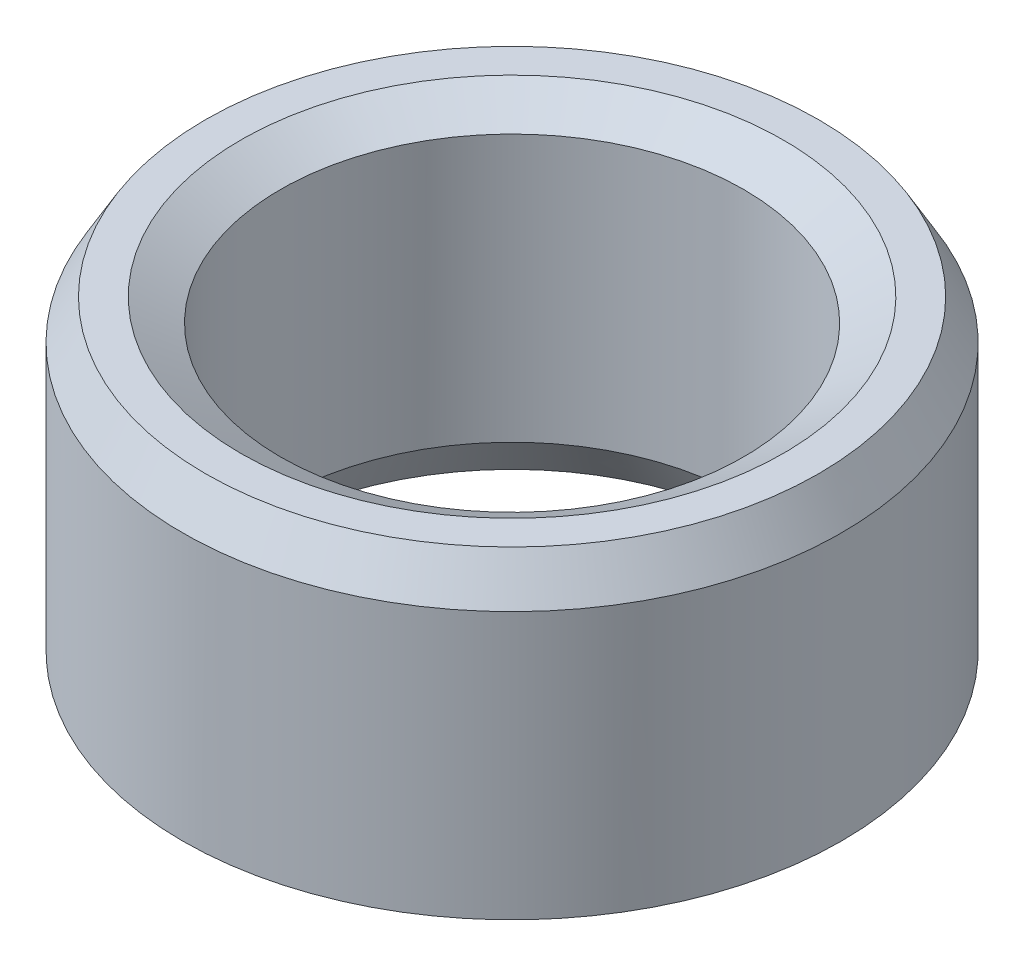
from build123d import *
from OCP.BRepFilletAPI import BRepFilletAPI_MakeChamfer

# Parameters (mm, degrees)
SKETCH1_R           = 30
BOSS_EXTRUDE1_DEPTH = 29.999267997
SKETCH2_R           = 21.0873478
CUT_EXTRUDE1_DEPTH  = 52.961101608
CHAMFER1_SIZE       = 3.616942183
CHAMFER1_SIZE2      = 2.088242543


with BuildPart() as part:
    # Sketch1 → Boss-Extrude1 (new body)
    with BuildSketch(Plane(origin=(0, 0, 0), x_dir=(1, 0, 0), z_dir=(0, 1, 0))):
        Circle(SKETCH1_R)
    extrude(amount=BOSS_EXTRUDE1_DEPTH)

    # Sketch2 → Cut-Extrude1 (cut, through all)
    with BuildSketch(Plane(origin=(0, 0, 0), x_dir=(1, 0, 0), z_dir=(0, 1, 0))):
        Circle(SKETCH2_R)
    extrude(amount=CUT_EXTRUDE1_DEPTH, mode=Mode.SUBTRACT)

    # Chamfer1: one chamfer whose edges measure the first distance from different faces: ONE call of the kernel's chamfer builder (chamfer() names one face for all edges)
    chamfer1_edges_1 = [part.edges().sort_by_distance(p)[0] for p in [
        (-21.0873478, 29.999267997, 0),
    ]]
    chamfer1_side_1 = [part.faces().sort_by_distance(p)[0] for p in [
        (-29.151471863, 29.999267997, 0),
    ]]
    chamfer1_edges_2 = [part.edges().sort_by_distance(p)[0] for p in [
        (-21.0873478, 0, 0),
    ]]
    chamfer1_side_2 = [part.faces().sort_by_distance(p)[0] for p in [
        (-21.0873478, 14.999633999, 0),
    ]]
    chamfer1_edges_3 = [part.edges().sort_by_distance(p)[0] for p in [
        (-30, 0, 0),
    ]]
    chamfer1_side_3 = [part.faces().sort_by_distance(p)[0] for p in [
        (-29.151471863, 0, 0),
    ]]
    chamfer1_edges_4 = [part.edges().sort_by_distance(p)[0] for p in [
        (-30, 29.999267997, 0),
    ]]
    chamfer1_side_4 = [part.faces().sort_by_distance(p)[0] for p in [
        (-30, 14.999633999, 0),
    ]]
    chamfer1 = BRepFilletAPI_MakeChamfer(part.part.solid().wrapped)
    for e in chamfer1_edges_1:
        chamfer1.Add(CHAMFER1_SIZE, CHAMFER1_SIZE2, e.wrapped, chamfer1_side_1[0].wrapped)  # the first distance lies on this face
    for e in chamfer1_edges_2:
        chamfer1.Add(CHAMFER1_SIZE, CHAMFER1_SIZE2, e.wrapped, chamfer1_side_2[0].wrapped)  # the first distance lies on this face
    for e in chamfer1_edges_3:
        chamfer1.Add(CHAMFER1_SIZE, CHAMFER1_SIZE2, e.wrapped, chamfer1_side_3[0].wrapped)  # the first distance lies on this face
    for e in chamfer1_edges_4:
        chamfer1.Add(CHAMFER1_SIZE, CHAMFER1_SIZE2, e.wrapped, chamfer1_side_4[0].wrapped)  # the first distance lies on this face
    add(Compound.cast(chamfer1.Shape()), mode=Mode.REPLACE)


solid = part.part
